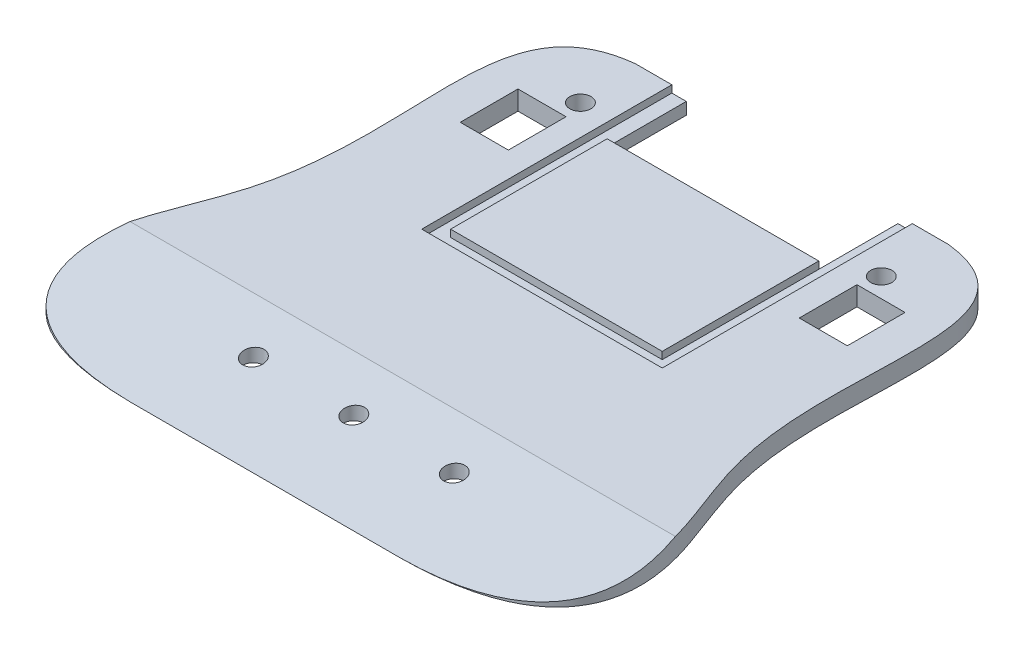
from build123d import *

# Parameters (mm, degrees)
BOSS_EXTRUDE5_DEPTH     = 2
CUT_EXTRUDE1_DEPTH      = 69.868259305
CUT_EXTRUDE1_DEPTH_BACK = 69.868259305
SKETCH8_W               = 22
SKETCH8_H               = 8.227670612
CUT_EXTRUDE4_DEPTH      = 69.868259305
SKETCH11_W              = 5
SKETCH11_H              = 6
RESISTOR_ACCESS_DEPTH   = 69.868259305
CUT_EXTRUDE7_DEPTH      = 0.75
SKETCH1_R               = 1.1
CUT_EXTRUDE9_DEPTH      = 69.868259305


with BuildPart() as part:
    # Sketch10 → Boss-Extrude5 (new body)
    with BuildSketch(Plane.XZ):
        with BuildLine():
            Line((6.837324277, 47.478884144), (34.939575723, 47.478884144))
            add(Edge.make_bspline(
                [(34.939575723, 47.478884144), (46.004119778, 47.361742932), (53.747142248, 42.008756664), (40.383549006, 12.555786321), (49.943454149, -5.755757587), (37.177203846, -7.228786468)],
                knots=[0, 0, 0, 0, 0.415677345, 0.515677345, 1, 1, 1, 1], degree=3))
            Line((37.177203846, -7.228786468), (4.599696154, -7.228786468))
            add(Edge.make_bspline(
                [(6.837324277, 47.478884144), (-4.227219778, 47.361742932), (-11.970242248, 42.008756664), (1.393350994, 12.555786321), (-8.166554149, -5.755757587), (4.599696154, -7.228786468)],
                knots=[0, 0, 0, 0, 0.415677345, 0.515677345, 1, 1, 1, 1], degree=3))
        make_face()
    extrude(amount=BOSS_EXTRUDE5_DEPTH)

    # Sketch2 → Cut-Extrude1 (cut, two sides: drawn at the far end of the back side and taken through both)
    with BuildSketch(Plane.ZY.offset(-CUT_EXTRUDE1_DEPTH_BACK)):
        Polygon((47.478884144, -2), (33.248144699, 0), (47.478884144, 0), align=None)
    extrude(amount=CUT_EXTRUDE1_DEPTH + CUT_EXTRUDE1_DEPTH_BACK, mode=Mode.SUBTRACT)

    # Sketch8 → Cut-Extrude4 (cut, through all)
    with BuildSketch(Plane.XZ.offset(2)):
        with Locations((20.88845, -3.114951162)):
            Rectangle(SKETCH8_W, SKETCH8_H)
    extrude(amount=-CUT_EXTRUDE4_DEPTH, mode=Mode.SUBTRACT)

    # Sketch11 → resistor_access (cut, through all)
    with BuildSketch(Plane(origin=(0, -2, 0), x_dir=(-1, 0, 0), z_dir=(0, -1, 0))):
        with Locations((-3.269993, -4.148884144)):
            Rectangle(SKETCH11_W, SKETCH11_H)
        with Locations((-38.506907, -4.148884144)):
            Rectangle(SKETCH11_W, SKETCH11_H)
    extrude(amount=-RESISTOR_ACCESS_DEPTH, mode=Mode.SUBTRACT)

    # Sketch15 → Cut-Extrude7 (cut)
    with BuildSketch(Plane(origin=(0, 0, 0), x_dir=(1, 0, 0), z_dir=(0, 1, 0))):
        Polygon((31.88845, 7.228786468), (33.38845, 7.228786468), (33.38845, -18.771213532), (8.38845, -18.771213532), (8.38845, 7.228786468), (9.88845, 7.228786468), (9.88845, -17.271213532), (31.88845, -17.271213532), align=None)
    extrude(amount=-CUT_EXTRUDE7_DEPTH, mode=Mode.SUBTRACT)

    # Sketch1 → Cut-Extrude9 (cut, through all)
    with BuildSketch(Plane.XZ.offset(2)):
        with Locations((10.449993, 38.328884144)):
            Circle(SKETCH1_R)
        with Locations((20.88845, 38.328884144)):
            Circle(SKETCH1_R)
        with Locations((31.326907, 38.328884144)):
            Circle(SKETCH1_R)
        with Locations((5.249993, -0.861115856)):
            Circle(SKETCH1_R)
        with Locations((36.526907, -0.861115856)):
            Circle(SKETCH1_R)
    extrude(amount=-CUT_EXTRUDE9_DEPTH, mode=Mode.SUBTRACT)


solid = part.part
